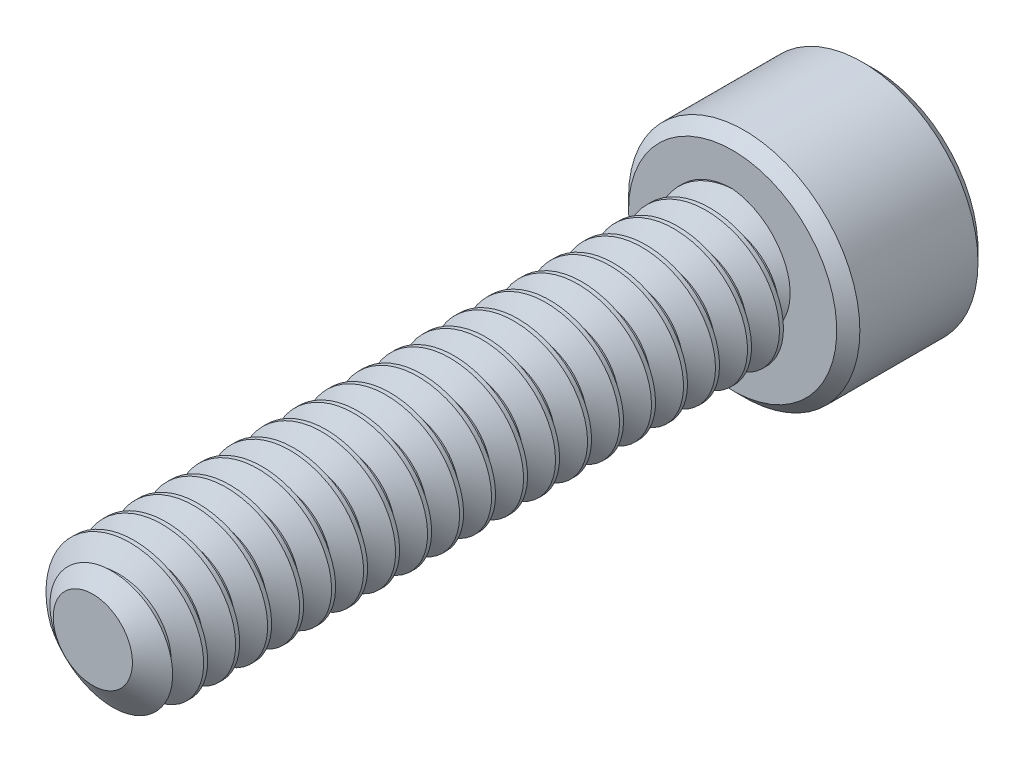
from build123d import *

# Parameters (mm, degrees)
SKETCH1_R          = 1.7526
EXTRUDE1_DEPTH     = 15.875
CUT_SWEEP1_PITCH   = 0.79375
SKETCH6_R          = 2.8702
EXTRUDE2_DEPTH     = 3.5052
CUT_EXTRUDE1_DEPTH = 2.08359375
CHAMFER1_SIZE      = 0.28702


with BuildPart() as part:
    # Sketch1 → Extrude1 (new body)
    with BuildSketch(Plane.XY):
        Circle(SKETCH1_R)
    extrude(amount=-EXTRUDE1_DEPTH)

    # Cut-Sweep1: the profile of Sketch3 profile screwed along a right-hand helix of 21 turns, 6 arcs to a turn; built about Z, then put on its axis
    cut_sweep1_z = Axis((0, 0, 0), (0, 0, 1))
    cut_sweep1_corners = [(1.7529, 0, -0.694704455), (1.237044252, 0, -0.396875), (1.237044252, 0, -0.29765625), (1.7529, 0, 0.000173205)]
    with BuildLine(mode=Mode.PRIVATE) as cut_sweep1_profile:
        Line(cut_sweep1_corners[0], cut_sweep1_corners[1])
        Line(cut_sweep1_corners[1], cut_sweep1_corners[2])
        Line(cut_sweep1_corners[2], cut_sweep1_corners[3])
        Line(cut_sweep1_corners[3], cut_sweep1_corners[0])
    cut_sweep1_cap = Face(cut_sweep1_profile.wire())
    cut_sweep1_turn_angles = [0, 30, 60, 90, 120, 150, 180, 210, 240, 270, 300, 330, 360]
    cut_sweep1_turn_weights = [1, 0.8660254037844387, 1, 0.8660254037844387, 1, 0.8660254037844387, 1, 0.8660254037844387, 1, 0.8660254037844387, 1, 0.8660254037844387, 1]
    cut_sweep1_turn_rails = [Edge.make_bspline([Vector(p[0], p[1], 0).rotate(cut_sweep1_z, cut_sweep1_turn_angles[k]) / cut_sweep1_turn_weights[k] + Vector(0, 0, p[2] + CUT_SWEEP1_PITCH * cut_sweep1_turn_angles[k] / 360) for k in range(13)], [0, 0, 0, 1, 1, 2, 2, 3, 3, 4, 4, 5, 5, 6, 6, 6], 2, cut_sweep1_turn_weights) for p in cut_sweep1_corners]
    cut_sweep1_turn_sides = [Face.make_surface_from_curves(cut_sweep1_turn_rails[p[0]], cut_sweep1_turn_rails[p[1]]) for p in [(0, 1), (1, 2), (2, 3), (3, 0)]]
    cut_sweep1 = Plane(origin=(0, 0, 0), x_dir=(0, 1, 0), z_dir=(0, 0, -1)) * Solid(Shell([*[p.moved(Location((0, 0, CUT_SWEEP1_PITCH * i))) for i in range(21) for p in cut_sweep1_turn_sides], cut_sweep1_cap, cut_sweep1_cap.rotate(cut_sweep1_z, 7560).moved(Location((0, 0, CUT_SWEEP1_PITCH * 7560 / 360)))]))
    add(cut_sweep1, mode=Mode.SUBTRACT)

    # Sketch4 → Cut-Revolve1 (revolve, cut)
    with BuildSketch(Plane(origin=(0, 0, 0), x_dir=(0, 0, -1), z_dir=(1, 0, 0)), mode=Mode.PRIVATE) as cut_revolve1_sk:
        Polygon((0.538848736, 1.7526), (0, 0.983044252), (0, 1.7526), align=None)
    revolve(cut_revolve1_sk.sketch.rotate(Axis((0, 0, 0), (0, 0, -1)), 261.048315518), axis=Axis((0, 0, 0), (0, 0, -1)), mode=Mode.SUBTRACT)

    # Sketch6 → Extrude2 (add)
    with BuildSketch(Plane(origin=(0, 0, -15.875), x_dir=(-1, 0, 0), z_dir=(0, 0, -1))):
        Circle(SKETCH6_R)
    extrude(amount=EXTRUDE2_DEPTH)

    # Sketch7 → Cut-Extrude1 (cut)
    with BuildSketch(Plane(origin=(0, 0, -19.3802), x_dir=(-1, 0, 0), z_dir=(0, 0, -1))):
        Polygon((0, 1.603951217), (-1.3890625, 0.801975608), (-1.3890625, -0.801975608), (0, -1.603951217), (1.3890625, -0.801975608), (1.3890625, 0.801975608), align=None)
    extrude(amount=-CUT_EXTRUDE1_DEPTH, mode=Mode.SUBTRACT)

    # Cut-Extrude2 cone 1 section (through the dimple's axis) → Cut-Extrude2 (revolve, cut)
    with BuildSketch(Plane(origin=(0, 0, -19.3802), x_dir=(0, 1, 0), z_dir=(1, 0, 0))):
        Polygon((0, 0), (1.603951217, 0), (0, 1.603951217), align=None)
    revolve(axis=Axis((0, 0, -19.3802), (0, 0, 1)), mode=Mode.SUBTRACT)

    # Chamfer1
    chamfer1_edges = [part.edges().sort_by_distance(p)[0] for p in [
        (2.8702, 0, -15.875),
        (2.8702, 0, -19.3802),
    ]]
    chamfer(chamfer1_edges, length=CHAMFER1_SIZE)


solid = part.part
